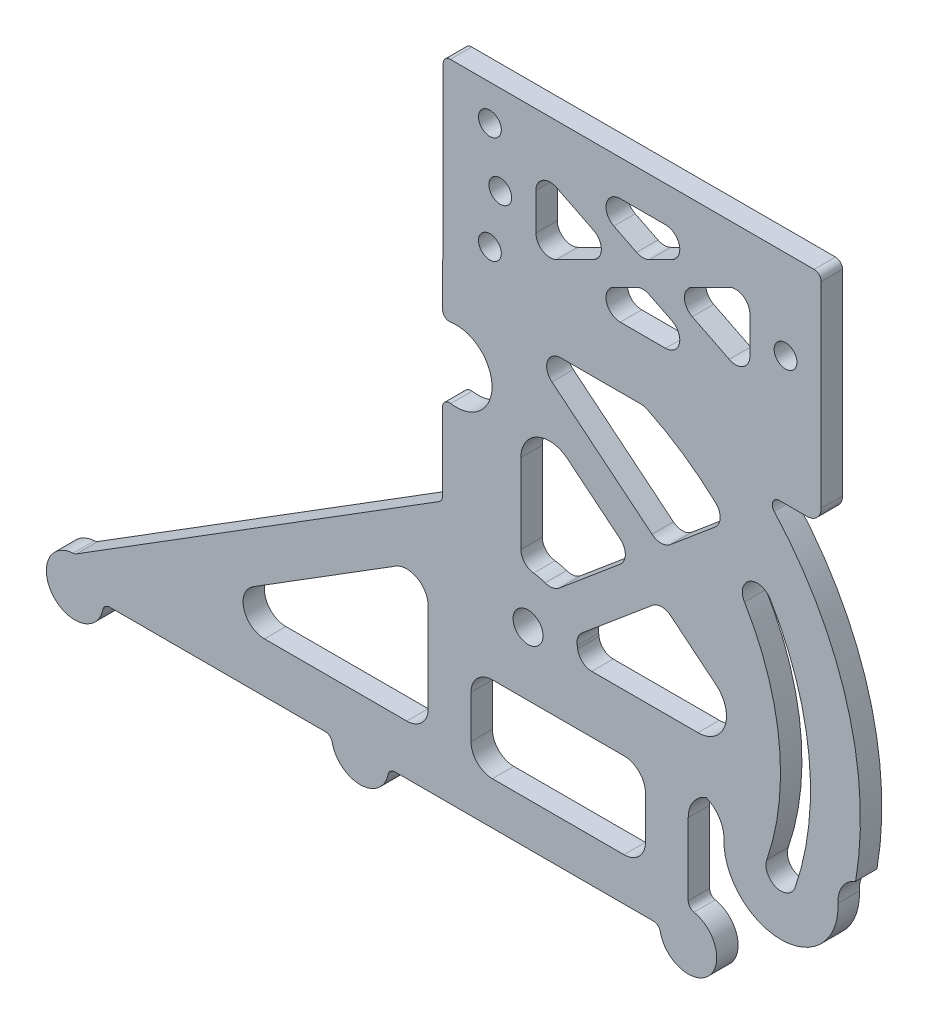
from build123d import *

# Parameters (mm, degrees)
SKETCH_1_R          = 1.6
SKETCH_1_R_2        = 2.1
EXTRUDE_1_DEPTH     = 3
CUT_EXTRUDE_1_DEPTH = 3
FILLET_1_R          = 2
FILLET_3_R          = 1
FILLET_4_R          = 4
SKETCH_3_W          = 24.456946585
SKETCH_3_H          = 12
EXTRUDE_2_DEPTH     = 3
FILLET_7_R          = 3
FILLET_8_R          = 1
FILLET_9_R          = 4


with BuildPart() as part:
    # 草图1 → 凸台-拉伸1 (new body)
    with BuildSketch(Plane.XY):
        with BuildLine():
            Line((-6.55, 5), (-6.55, -20))
            Line((-6.55, -20), (-6.65, -20))
            Line((-6.65, -20), (-6.65, -27.226457264))
            ThreePointArc((-6.65, -27.226457264), (0.294670949, -31.832784966), (-6.65, -36.439112668))
            Line((-6.65, -36.439112668), (-6.65, -66.4))
            Line((-6.65, -66.4), (27.321635963, -66.4))
            Line((27.321635963, -66.4), (34.066457534, -66.4))
            ThreePointArc((34.066457534, -66.4), (40.806946585, -78.708805792), (47.547435636, -66.4))
            Line((47.547435636, -66.4), (51.275483122, -66.4))
            ThreePointArc((51.275483122, -66.4), (49.753339314, -44.361278071), (38.252279556, -25.5))
            Line((38.252279556, -25.5), (46.45, -25.5))
            Line((46.45, -25.5), (46.45, 5))
            Line((46.45, 5), (-6.55, 5))
        make_face()
        Circle(SKETCH_1_R, mode=Mode.SUBTRACT)
        with Locations((0, -15)):
            Circle(SKETCH_1_R, mode=Mode.SUBTRACT)
        with Locations((41.45, -7.5)):
            Circle(SKETCH_1_R, mode=Mode.SUBTRACT)
        with Locations((1.45, -7.5)):
            Circle(SKETCH_1_R, mode=Mode.SUBTRACT)
        with Locations((5.35, -58.5)):
            Circle(SKETCH_1_R_2, mode=Mode.SUBTRACT)
        with BuildLine():
            ThreePointArc((39.293825108, -38.104492234), (36.412193819, -37.386020859), (35.693722445, -40.267652148))
            ThreePointArc((35.693722445, -40.267652148), (40.556075096, -54.7996924), (38.821357576, -70.025112668))
            ThreePointArc((38.821357576, -70.025112668), (40.123253461, -72.694394801), (42.792535594, -71.392498917))
            ThreePointArc((42.792535594, -71.392498917), (44.733067057, -54.360672855), (39.293825108, -38.104492234))
        make_face(mode=Mode.SUBTRACT)
    extrude(amount=EXTRUDE_1_DEPTH)

    # 草图2 → 切除-拉伸1 (cut)
    with BuildSketch(Plane.XY.offset(3)):
        with BuildLine():
            Line((8.751696447, -52.382119543), (20.12106304, -42.842088228))
            Line((20.12106304, -42.842088228), (4.35, -29.956658925))
            Line((4.35, -29.956658925), (4.35, -51.57179677))
            ThreePointArc((4.35, -51.57179677), (6.617356384, -51.615683927), (8.751696447, -52.382119543))
        make_face()
        with BuildLine():
            Line((11.965634495, -56.212341759), (24.062202011, -46.062116418))
            Line((24.062202011, -46.062116418), (40.387044425, -59.4))
            Line((40.387044425, -59.4), (12.291901757, -59.4))
            ThreePointArc((12.291901757, -59.4), (12.313618928, -57.787250794), (11.965634495, -56.212341759))
        make_face()
        with BuildLine():
            Line((4.35, -23.5), (24.01970683, -39.570737661))
            Line((24.01970683, -39.570737661), (30.523428477, -34.113467226))
            Line((30.523428477, -34.113467226), (33.250263459, -31.825380998))
            ThreePointArc((33.250263459, -31.825380998), (27.82773831, -27.119890369), (21.62759196, -23.5))
            Line((21.62759196, -23.5), (4.35, -23.5))
        make_face()
        Polygon((6.45, -13.322949017), (18.095898034, -7.5), (6.45, -1.677050983), align=None)
        Polygon((36.45, -1.677050983), (24.804101966, -7.5), (36.45, -13.322949017), align=None)
        Polygon((9.804101966, 0), (21.45, -5.822949017), (33.095898034, 0), align=None)
        Polygon((33.095898034, -15), (9.804101966, -15), (21.45, -9.177050983), align=None)
    extrude(amount=-CUT_EXTRUDE_1_DEPTH, mode=Mode.SUBTRACT)

    # 圆角1
    # the kernel refuses this fillet: 2 mm, written as the material it adds along each edge
    with BuildSketch(Plane(origin=(33.095898034, -15, 3), x_dir=(-0.8944271909999163, 0.4472135954999571, 0), z_dir=(0, 0, -1)), Plane(origin=(9.804101966, 0, 3), x_dir=(0.8944271909999155, -0.44721359549995865, 0), z_dir=(0, 0, -1))) as fillet_1_piece_1:
        with BuildLine():
            CenterArc((FILLET_1_R * 4.2360679775, -FILLET_1_R), FILLET_1_R, 90, 153.434948823)
            Line((FILLET_1_R * 3.788854382, -FILLET_1_R * 1.894427191), (0, 0))
            Line((0, 0), (FILLET_1_R * 4.2360679775, 0))
        make_face()
    extrude(amount=3)
    with BuildSketch(Plane(origin=(21.45, -9.177050983, 3), x_dir=(0.8944271909999166, -0.44721359549995654, 0), z_dir=(0, 0, -1)), Plane(origin=(21.45, -5.822949017, 3), x_dir=(-0.8944271909999162, 0.4472135954999572, 0), z_dir=(0, 0, -1))) as fillet_1_piece_2:
        with BuildLine():
            CenterArc((FILLET_1_R * 0.5, FILLET_1_R), FILLET_1_R, 216.869897646, 53.130102354)
            Line((-FILLET_1_R * 0.3, FILLET_1_R * 0.4), (0, 0))
            Line((0, 0), (FILLET_1_R * 0.5, 0))
        make_face()
    extrude(amount=3)
    with BuildSketch(Plane(origin=(36.45, -1.677050983, 3), x_dir=(-0.8944271909999159, -0.4472135954999579, 0), z_dir=(0, 0, -1)), Plane(origin=(6.45, -13.322949017, 3), x_dir=(0.8944271909999159, 0.4472135954999579, 0), z_dir=(0, 0, -1))) as fillet_1_piece_3:
        with BuildLine():
            CenterArc((FILLET_1_R * 1.61803398875, -FILLET_1_R), FILLET_1_R, 90, 116.565051177)
            Line((FILLET_1_R * 0.72360679775, -FILLET_1_R * 1.4472135955), (0, 0))
            Line((0, 0), (FILLET_1_R * 1.61803398875, 0))
        make_face()
    extrude(amount=3)
    with BuildSketch(Plane(origin=(24.804101966, -7.5, 3), x_dir=(0.8944271909999156, 0.44721359549995826, 0), z_dir=(0, 0, -1)), Plane(origin=(18.095898034, -7.5, 3), x_dir=(-0.8944271909999161, -0.4472135954999576, 0), z_dir=(0, 0, -1))) as fillet_1_piece_4:
        with BuildLine():
            CenterArc((FILLET_1_R * 2, FILLET_1_R), FILLET_1_R, 143.130102354, 126.869897646)
            Line((FILLET_1_R * 1.2, FILLET_1_R * 1.6), (0, 0))
            Line((0, 0), (FILLET_1_R * 2, 0))
        make_face()
    extrude(amount=3)
    with BuildSketch(Plane(origin=(36.45, -13.322949017, 3), x_dir=(-0.8944271909999161, 0.4472135954999575, 0), z_dir=(0, 0, -1)), Plane(origin=(6.45, -1.677050983, 3), x_dir=(0.8944271909999161, -0.4472135954999575, 0), z_dir=(0, 0, -1))) as fillet_1_piece_5:
        with BuildLine():
            CenterArc((FILLET_1_R * 1.61803398875, FILLET_1_R), FILLET_1_R, 153.434948823, 116.565051177)
            Line((FILLET_1_R * 0.72360679775, FILLET_1_R * 1.4472135955), (0, 0))
            Line((0, 0), (FILLET_1_R * 1.61803398875, 0))
        make_face()
    extrude(amount=3)
    with BuildSketch(Plane(origin=(33.095898034, 0, 3), x_dir=(-0.8944271909999161, -0.4472135954999576, 0), z_dir=(0, 0, -1)), Plane(origin=(9.804101966, -15, 3), x_dir=(0.8944271909999159, 0.44721359549995765, 0), z_dir=(0, 0, -1))) as fillet_1_piece_6:
        with BuildLine():
            CenterArc((FILLET_1_R * 4.2360679775, FILLET_1_R), FILLET_1_R, 116.565051177, 153.434948823)
            Line((FILLET_1_R * 3.788854382, FILLET_1_R * 1.894427191), (0, 0))
            Line((0, 0), (FILLET_1_R * 4.2360679775, 0))
        make_face()
    extrude(amount=3)
    with BuildSketch(Plane(origin=(12.291901757, -59.4, 3), x_dir=(0.0031998610068025087, 0.9999948804316636, 0), z_dir=(0, 0, -1))) as fillet_1_piece_7:
        with BuildLine():
            CenterArc((2.006359478, 1.984213169), FILLET_1_R, 179.816661156, 82.979629251)
            Line((0.006369717, 1.990612891), (0, 0))
            ThreePointArc((0, 0), (0.877782272, 0.055253908), (1.755564543, 0))
        make_face()
    extrude(amount=3)
    with BuildSketch(Plane(origin=(24.062202011, -46.062116418, 3), x_dir=(0.7743943203164566, -0.6327032769486919, 0), z_dir=(0, 0, -1)), Plane(origin=(24.01970683, -39.570737661, 3), x_dir=(-0.7743943203164579, 0.6327032769486903, 0), z_dir=(0, 0, -1))) as fillet_1_piece_8:
        with BuildLine():
            CenterArc((FILLET_1_R * 0.828004927499, FILLET_1_R), FILLET_1_R, 190.750151795, 79.249848205)
            Line((-FILLET_1_R * 0.154444976062, FILLET_1_R * 0.813473361169), (0, 0))
            Line((0, 0), (FILLET_1_R * 0.828004927499, 0))
        make_face()
    extrude(amount=3)
    with BuildSketch(Plane(origin=(11.965634495, -56.212341759, 3), x_dir=(0.2510150170560356, -0.9679831926290653, 0), z_dir=(0, 0, -1))) as fillet_1_piece_9:
        with BuildLine():
            CenterArc((1.26580828, -1.993731306), FILLET_1_R, 94.537583786, 60)
            Line((-0.539926697, -1.133893419), (0, 0))
            ThreePointArc((0, 0), (0.553791123, -0.021940428), (1.107582245, 0))
        make_face()
    extrude(amount=3)
    with BuildSketch(Plane(origin=(8.751696447, -52.382119543, 3), x_dir=(0.7660444431189812, 0.6427876096865356, 0), z_dir=(0, 0, -1))) as fillet_1_piece_10:
        with BuildLine():
            CenterArc((1.255880219, -2), FILLET_1_R, 90, 60)
            ThreePointArc((-0.476170589, -1), (-0.218275995, -0.509432606), (0, 0))
            Line((0, 0), (1.255880219, 0))
        make_face()
    extrude(amount=3)
    with BuildSketch(Plane(origin=(20.12106304, -42.842088228, 3), x_dir=(-0.7660444431189825, -0.6427876096865339, 0), z_dir=(0, 0, -1))) as fillet_1_piece_11:
        with BuildLine():
            CenterArc((FILLET_1_R * 1.20772228134, FILLET_1_R), FILLET_1_R, 169.249848205, 100.750151795)
            Line((FILLET_1_R * 0.225272377779, FILLET_1_R * 1.18652663883), (0, 0))
            Line((0, 0), (FILLET_1_R * 1.20772228134, 0))
        make_face()
    extrude(amount=3)
    with BuildSketch(Plane(origin=(4.35, -51.57179677, 3), x_dir=(0, 1, 0), z_dir=(0, 0, -1))) as fillet_1_piece_12:
        with BuildLine():
            CenterArc((2.01606868, 2), FILLET_1_R, 186.379370208, 83.620629792)
            ThreePointArc((0.0284527, 1.777777778), (0.070900422, 0.887981841), (0, 0))
            Line((0, 0), (2.01606868, 0))
        make_face()
    extrude(amount=3)
    with BuildSketch(Plane(origin=(-6.55, -20, 0), x_dir=(0, 1, 0), z_dir=(0, 0, 1))) as fillet_1_piece_13:
        with BuildLine():
            CenterArc((0.6244998, 2), FILLET_1_R, 251.805127661, 18.194872339)
            Line((0, 0.1), (0, 0))
            Line((0, 0), (0.6244998, 0))
        make_face()
    extrude(amount=3)
    with BuildSketch(Plane(origin=(33.250263459, -31.825380998, 3), x_dir=(-0.7660444431189841, -0.642787609686532, 0), z_dir=(0, 0, -1))) as fillet_1_piece_14:
        with BuildLine():
            CenterArc((2.196649177, 2), FILLET_1_R, 172.937566446, 97.062433554)
            ThreePointArc((0.211823647, 2.245901639), (0.089501392, 1.12449858), (0, 0))
            Line((0, 0), (2.196649177, 0))
        make_face()
    extrude(amount=3)
    with BuildSketch(Plane(origin=(21.62759196, -23.5, 3), x_dir=(-1, 0, 0), z_dir=(0, 0, -1))) as fillet_1_piece_15:
        with BuildLine():
            CenterArc((0.44850481, -2), FILLET_1_R, 90, 25.625604553)
            ThreePointArc((-0.41647263, -0.196721311), (-0.208529741, -0.097739453), (0, 0))
            Line((0, 0), (0.44850481, 0))
        make_face()
    extrude(amount=3)
    with BuildSketch(Plane(origin=(4.35, -23.5, 3), x_dir=(1, 0, 0), z_dir=(0, 0, -1))) as fillet_1_piece_16:
        with BuildLine():
            CenterArc((FILLET_1_R * 2.80446519714, FILLET_1_R), FILLET_1_R, 129.249848205, 140.750151795)
            Line((FILLET_1_R * 2.17176192019, FILLET_1_R * 1.77439432032), (0, 0))
            Line((0, 0), (FILLET_1_R * 2.80446519714, 0))
        make_face()
    extrude(amount=3)
    # the kernel refuses this fillet: 2 mm, written as the material it takes off along each edge
    with BuildSketch(Plane(origin=(46.45, -25.5, -5), x_dir=(0, 1, 0), z_dir=(0, 0, 1))) as fillet_1_2_piece_1:
        with BuildLine():
            CenterArc((FILLET_1_R, FILLET_1_R), FILLET_1_R, 180, 90)
            Line((0, FILLET_1_R), (0, 0))
            Line((0, 0), (FILLET_1_R, 0))
        make_face()
    extrude(amount=13, mode=Mode.SUBTRACT)

    # 圆角3
    fillet_3_edges = [part.edges().sort_by_distance(p)[0] for p in [
        (46.45, 5, 1.5),
        (38.252279556, -25.5, 1.5),
        (-6.65, -36.439112668, 1.5),
        (-6.65, -27.226457264, 1.5),
        (-6.65, -20, 1.5),
        (-6.55, 5, 1.5),
    ]]
    fillet(fillet_3_edges, radius=FILLET_3_R)

    # 圆角4
    fillet_4_edges = [part.edges().sort_by_distance(p)[0] for p in [
        (4.35, -29.956658925, 1.5),
        (40.387044425, -59.4, 1.5),
    ]]
    fillet(fillet_4_edges, radius=FILLET_4_R)

    # 草图3 → 凸台-拉伸2 (add)
    with BuildSketch(Plane.XY.offset(3)):
        with BuildLine():
            Line((27.806946585, -81.4), (27.806946585, -66.4))
            Line((27.806946585, -66.4), (-6.65, -66.4))
            Line((-6.65, -66.4), (-6.65, -49.192325617))
            Line((-6.65, -49.192325617), (-58.193053415, -81.4))
            ThreePointArc((-58.193053415, -81.4), (-61.02148054, -88.228427125), (-54.193053415, -85.4))
            Line((-54.193053415, -85.4), (-22.193053415, -85.4))
            ThreePointArc((-22.193053415, -85.4), (-18.193053415, -89.4), (-14.193053415, -85.4))
            Line((-14.193053415, -85.4), (23.806946585, -85.4))
            ThreePointArc((23.806946585, -85.4), (30.63537371, -88.228427125), (27.806946585, -81.4))
        make_face()
        Polygon((-8.65, -57.517134741), (-42.069570339, -78.4), (-8.65, -78.4), align=None, mode=Mode.SUBTRACT)
        with Locations((9.578473293, -73.4)):
            Rectangle(SKETCH_3_W, SKETCH_3_H, mode=Mode.SUBTRACT)
    extrude(amount=-EXTRUDE_2_DEPTH)

    # 圆角7
    fillet_7_edges = [part.edges().sort_by_distance(p)[0] for p in [
        (-8.65, -57.517134741, 1.5),
        (-42.069570339, -78.4, 1.5),
        (-8.65, -78.4, 1.5),
        (-2.65, -67.4, 1.5),
        (-2.65, -79.4, 1.5),
        (21.806946585, -79.4, 1.5),
        (21.806946585, -67.4, 1.5),
    ]]
    fillet(fillet_7_edges, radius=FILLET_7_R)

    # 圆角8
    fillet_8_edges = [part.edges().sort_by_distance(p)[0] for p in [
        (-6.65, -49.192325617, 1.5),
        (-58.193053415, -81.4, 1.5),
        (-54.193053415, -85.4, 1.5),
        (-22.193053415, -85.4, 1.5),
        (-14.193053415, -85.4, 1.5),
        (23.806946585, -85.4, 1.5),
        (27.806946585, -81.4, 1.5),
    ]]
    fillet(fillet_8_edges, radius=FILLET_8_R)

    # 圆角9
    # the kernel refuses this fillet: 4 mm, written as the material it adds along each edge
    with BuildSketch(Plane(origin=(27.806946585, -66.4, 3), x_dir=(0, -1, 0), z_dir=(0, 0, -1))) as fillet_9_piece_1:
        with BuildLine():
            CenterArc((FILLET_9_R, -FILLET_9_R), FILLET_9_R, 90, 90)
            Line((0, -FILLET_9_R), (-FILLET_9_R * 0.02, -FILLET_9_R))
            Line((-FILLET_9_R * 0.02, -FILLET_9_R), (-FILLET_9_R * 0.02, FILLET_9_R * 0.02))
            Line((-FILLET_9_R * 0.02, FILLET_9_R * 0.02), (FILLET_9_R, FILLET_9_R * 0.02))
            Line((FILLET_9_R, FILLET_9_R * 0.02), (FILLET_9_R, 0))
        make_face()
    extrude(amount=3)
    with BuildSketch(Plane(origin=(34.066457534, -66.4, 0), x_dir=(-1, 0, 0), z_dir=(0, 0, 1))) as fillet_9_piece_2:
        with BuildLine():
            CenterArc((5.255536915, 4), FILLET_9_R, 178.525398167, 91.474601833)
            Line((1.256861593, 4.102935264), (1.176888087, 4.104993969))
            ThreePointArc((1.176888087, 4.104993969), (0.832169672, 1.989055834), (-0.067404891, 0.043088058))
            Line((-0.067404891, 0.043088058), (0, -0.08))
            Line((0, -0.08), (5.255536915, -0.08))
            Line((5.255536915, -0.08), (5.255536915, 0))
        make_face()
    extrude(amount=3)
    with BuildSketch(Plane(origin=(47.547435636, -66.4, 0), x_dir=(0.304773744568149, -0.9524247816084527, 0), z_dir=(0, 0, 1))) as fillet_9_piece_3:
        with BuildLine():
            CenterArc((5.123723318, 3.866509844), FILLET_9_R, 184.528573932, 70.627543649)
            Line((1.136210992, 3.550684813), (1.056460746, 3.544368312))
            ThreePointArc((1.056460746, 3.544368312), (0.491911514, 1.799724306), (-0.076193983, 0.0243819))
            Line((-0.076193983, 0.0243819), (0.020494893, -0.077330197))
            ThreePointArc((0.020494893, -0.077330197), (2.049489327, 0.186980312), (4.078483761, -0.077330197))
            Line((4.078483761, -0.077330197), (4.098978655, 0))
        make_face()
    extrude(amount=3)


solid = part.part
